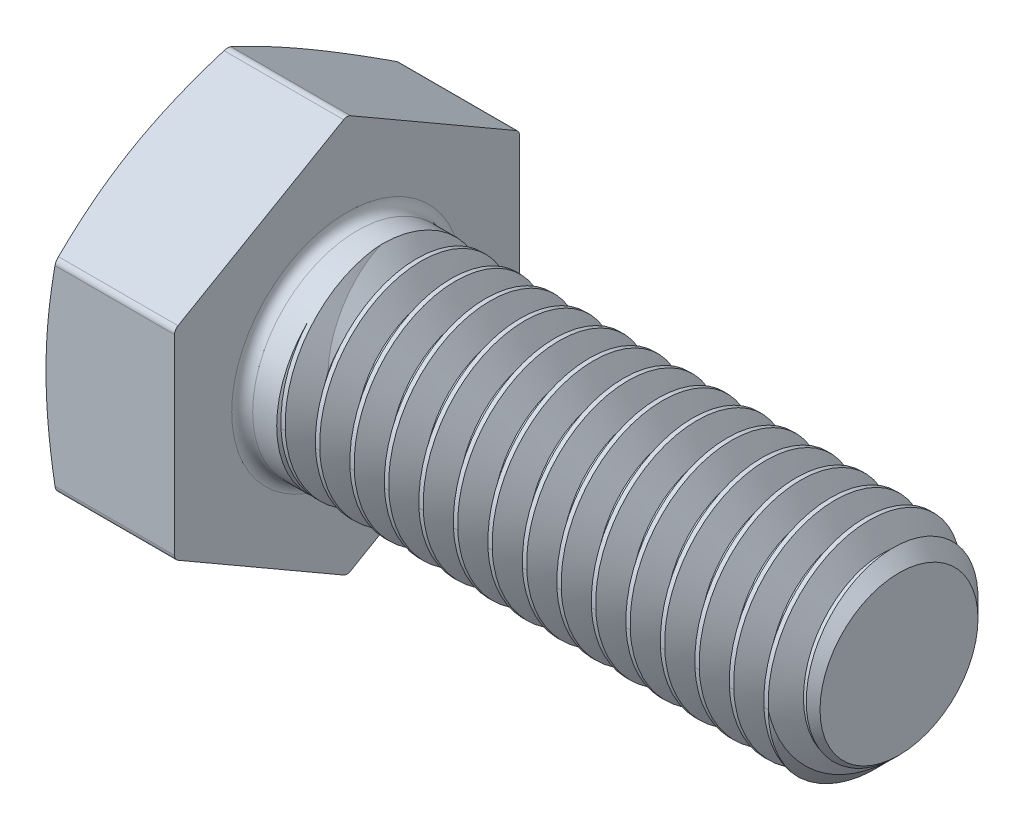
from build123d import *

# Parameters (mm, degrees)
SKETCH2_R           = 2.413
BOSS_EXTRUDE1_DEPTH = 12.7
BOSS_EXTRUDE2_DEPTH = 3.175
SKETCH5_OUTSIDE_W   = 31.38
SKETCH5_OUTSIDE_H   = 32.608
SKETCH5_OUTSIDE_R   = 3.3734375
CUT_EXTRUDE1_DEPTH  = 3.175
CUT_EXTRUDE1_DRAFT  = -70
FILLET7_R           = 0.15875
CHAMFER1_SIZE       = 0.5953125
FILLET4_R           = 0.2413
CUT_SWEEP1_PITCH    = 0.79375
CUT_SWEEP1_TO       = 11.90625


with BuildPart() as part:
    # Sketch2 → Boss-Extrude1 (new body)
    with BuildSketch(Plane(origin=(0, 0, 0), x_dir=(0, 0, -1), z_dir=(1, 0, 0))):
        Circle(SKETCH2_R)
    extrude(amount=BOSS_EXTRUDE1_DEPTH)

    # Sketch3 → Boss-Extrude2 (add)
    with BuildSketch(Plane.ZY):
        Polygon((0, 4.582717762), (-3.96875, 2.291358881), (-3.96875, -2.291358881), (0, -4.582717762), (3.96875, -2.291358881), (3.96875, 2.291358881), align=None)
    extrude(amount=BOSS_EXTRUDE2_DEPTH)


with BuildPart() as cut_extrude1_tool:
    # Sketch5 outside → Cut-Extrude1 (with draft: the straight prism first)
    with BuildSketch(Plane.ZY.offset(3.175)):
        Rectangle(SKETCH5_OUTSIDE_W, SKETCH5_OUTSIDE_H)
        Circle(SKETCH5_OUTSIDE_R, mode=Mode.SUBTRACT)
    extrude(amount=-CUT_EXTRUDE1_DEPTH)
    # Cut-Extrude1: the draft: its side faces are tilted about the plane it starts from
    cut_extrude1_sides = [cut_extrude1_tool.faces().sort_by_distance(p)[0] for p in [
        (-1.5875, -16.304, 0),
        (-1.5875, 0, 15.69),
        (-1.5875, 16.304, 0),
        (-1.5875, 0, -15.69),
        (-1.5875, 0, -3.3734375),
    ]]
    draft(cut_extrude1_sides, Plane.ZY.offset(3.175), CUT_EXTRUDE1_DRAFT)


with BuildPart() as part_1:
    add(part.part)

    # Cut-Extrude1: cut by cut_extrude1_tool
    add(cut_extrude1_tool.part, mode=Mode.SUBTRACT)

    # Fillet7
    fillet7_edges = [part_1.edges().sort_by_distance(p)[0] for p in [
        (-1.36742899, -4.582717762, 0),
        (-1.36742899, -2.291358881, -3.96875),
        (-1.36742899, 2.291358881, -3.96875),
        (-1.36742899, 4.582717762, 0),
        (-1.36742899, -2.291358881, 3.96875),
        (-1.36742899, 2.291358881, 3.96875),
    ]]
    fillet(fillet7_edges, radius=FILLET7_R)

    # Chamfer1
    chamfer1_edges = [part_1.edges().sort_by_distance(p)[0] for p in [
        (12.7, 0, 2.413),
    ]]
    chamfer(chamfer1_edges, length=CHAMFER1_SIZE)

    # Fillet4
    fillet4_edges = [part_1.edges().sort_by_distance(p)[0] for p in [
        (0, 0, 2.413),
    ]]
    fillet(fillet4_edges, radius=FILLET4_R)


with BuildPart() as body_2:
    # Split1: the piece on the far side of the plane
    add(part_1.part)
    split(bisect_by=Plane(origin=(0.79375, 0, 0), x_dir=(0, 0, 1), z_dir=(1, 0, 0)), keep=Keep.BOTTOM)


with BuildPart() as part_2:
    add(part_1.part)

    # Split1
    split(bisect_by=Plane(origin=(0.79375, 0, 0), x_dir=(0, 0, 1), z_dir=(1, 0, 0)), keep=Keep.TOP)

    # Cut-Sweep1: arcs per turn and ends read off the stored shape
    # Cut-Sweep1: the profile of Sketch13 profile screwed along a right-hand helix through 17 turns, 8 arcs to a turn; built about Z, then put on its axis
    cut_sweep1_z = Axis((0, 0, 0), (0, 0, 1))
    cut_sweep1_corners = [(2.4133, 0, 0.000173205), (2.4133, 0, -0.694704455), (1.897444252, 0, -0.396875), (1.897444252, 0, -0.29765625)]
    with BuildLine(mode=Mode.PRIVATE) as cut_sweep1_profile:
        Line(cut_sweep1_corners[0], cut_sweep1_corners[1])
        Line(cut_sweep1_corners[1], cut_sweep1_corners[2])
        Line(cut_sweep1_corners[2], cut_sweep1_corners[3])
        Line(cut_sweep1_corners[3], cut_sweep1_corners[0])
    cut_sweep1_cap = Face(cut_sweep1_profile.wire())
    cut_sweep1_turn_angles = [0, 22.5, 45, 67.5, 90, 112.5, 135, 157.5, 180, 202.5, 225, 247.5, 270, 292.5, 315, 337.5, 360]
    cut_sweep1_turn_weights = [1, 0.9238795325112867, 1, 0.9238795325112867, 1, 0.9238795325112867, 1, 0.9238795325112867, 1, 0.9238795325112867, 1, 0.9238795325112867, 1, 0.9238795325112867, 1, 0.9238795325112867, 1]
    cut_sweep1_turn_rails = [Edge.make_bspline([Vector(p[0], p[1], 0).rotate(cut_sweep1_z, cut_sweep1_turn_angles[k]) / cut_sweep1_turn_weights[k] + Vector(0, 0, p[2] + CUT_SWEEP1_PITCH * cut_sweep1_turn_angles[k] / 360) for k in range(17)], [0, 0, 0, 1, 1, 2, 2, 3, 3, 4, 4, 5, 5, 6, 6, 7, 7, 8, 8, 8], 2, cut_sweep1_turn_weights) for p in cut_sweep1_corners]
    cut_sweep1_turn_sides = [Face.make_surface_from_curves(cut_sweep1_turn_rails[p[0]], cut_sweep1_turn_rails[p[1]]) for p in [(0, 1), (1, 2), (2, 3), (3, 0)]]
    cut_sweep1 = Plane(origin=(12.7, 0, 0), x_dir=(0, 1, 0), z_dir=(-1, 0, 0)) * split(Solid(Shell([*[p.moved(Location((0, 0, CUT_SWEEP1_PITCH * i))) for i in range(17) for p in cut_sweep1_turn_sides], cut_sweep1_cap, cut_sweep1_cap.rotate(cut_sweep1_z, 6120).moved(Location((0, 0, CUT_SWEEP1_PITCH * 6120 / 360)))])), bisect_by=Plane.XY.offset(CUT_SWEEP1_TO), keep=Keep.BOTTOM, mode=Mode.PRIVATE)
    add(cut_sweep1, mode=Mode.SUBTRACT)

    add(body_2.part)  # Boss-Extrude4 merges body 2
    # Boss-Extrude4: read off the stored shape, not the designer's step
    # Boss-Extrude4 outline → Boss-Extrude4 (revolve)
    with BuildSketch(Plane.YX):
        Polygon((2.413, 0.79375), (1.897439704, 1.226356454), (1.897439704, 0.79375), align=None)
    revolve(axis=Axis((0, 0, 0), (1, 0, 0)))


solid = part_2.part
